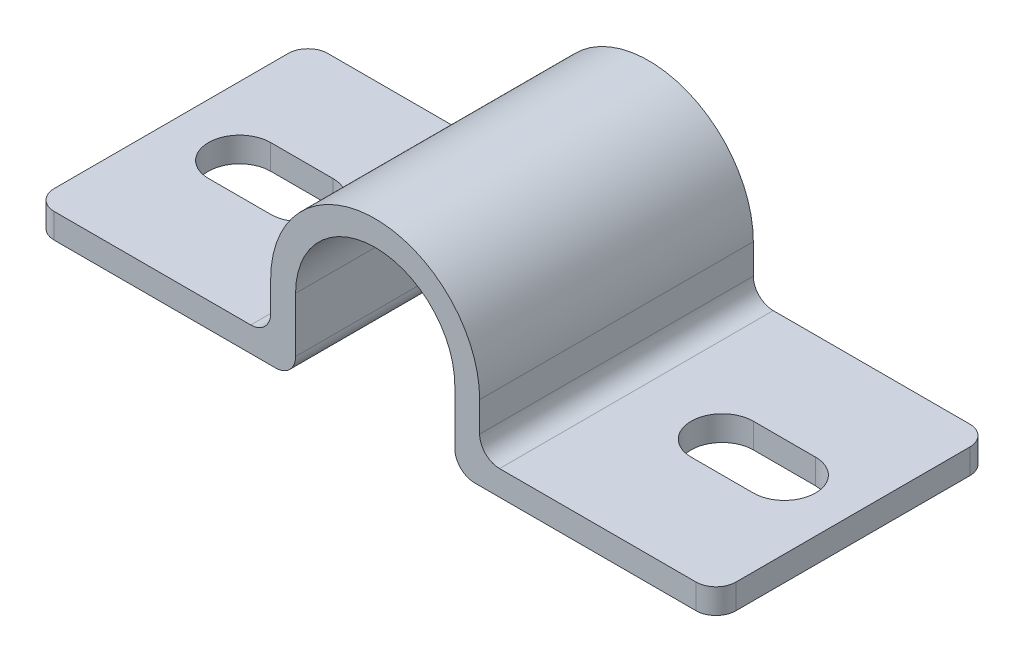
from build123d import *

# Parameters (mm, degrees)
BOSS_EXTRUDE1_DEPTH = 17.4625
VARFILLET1_R        = 2.54
CUT_EXTRUDE1_DEPTH  = 34.925


with BuildPart() as part:
    # Sketch1 → Boss-Extrude1 (new, symmetric)
    with BuildSketch(Plane.XY):
        with BuildLine():
            Line((-13.335, 0), (-13.335, -6.35))
            Line((-13.335, -6.35), (-43.4975, -6.35))
            Line((-43.4975, -6.35), (-43.4975, -9.525))
            Line((-43.4975, -9.525), (-10.16, -9.525))
            Line((-10.16, -9.525), (-10.16, 0))
            ThreePointArc((-10.16, 0), (3e-07, 10.16), (10.16, -6e-07))
            Line((10.16, -6e-07), (10.16, -9.525))
            Line((10.16, -9.525), (43.4975, -9.525))
            Line((43.4975, -9.525), (43.4975, -6.35))
            Line((43.4975, -6.35), (13.335, -6.35))
            Line((13.335, -6.35), (13.335, 0))
            ThreePointArc((13.335, 0), (0, 13.335), (-13.335, 0))
        make_face()
    extrude(amount=BOSS_EXTRUDE1_DEPTH, both=True)

    # VarFillet1
    varfillet1_edges = [part.edges().sort_by_distance(p)[0] for p in [
        (13.335, -6.35, 0),
        (-13.335, -6.35, 0),
        (10.16, -9.525, 0),
        (-10.16, -9.525, 0),
        (-43.4975, -7.9375, -17.4625),
        (-43.4975, -7.9375, 17.4625),
        (43.4975, -7.9375, -17.4625),
        (43.4975, -7.9375, 17.4625),
    ]]
    fillet(varfillet1_edges, radius=VARFILLET1_R)

    # Sketch2 → Cut-Extrude1 (cut)
    with BuildSketch(Plane(origin=(0, 0, 0), x_dir=(1, 0, 0), z_dir=(0, 1, 0))):
        with BuildLine():
            Line((-34.76625, 3.96875), (-26.82875, 3.96875))
            ThreePointArc((-26.82875, 3.96875), (-22.86, 0), (-26.82875, -3.96875))
            Line((-26.82875, -3.96875), (-34.76625, -3.96875))
            ThreePointArc((-34.76625, -3.96875), (-38.735, 0), (-34.76625, 3.96875))
        make_face()
        with BuildLine():
            Line((34.76625, -3.96875), (26.82875, -3.96875))
            ThreePointArc((26.82875, -3.96875), (22.86, 0), (26.82875, 3.96875))
            Line((26.82875, 3.96875), (34.76625, 3.96875))
            ThreePointArc((34.76625, 3.96875), (38.735, 0), (34.76625, -3.96875))
        make_face()
    extrude(amount=-CUT_EXTRUDE1_DEPTH, mode=Mode.SUBTRACT)


solid = part.part
